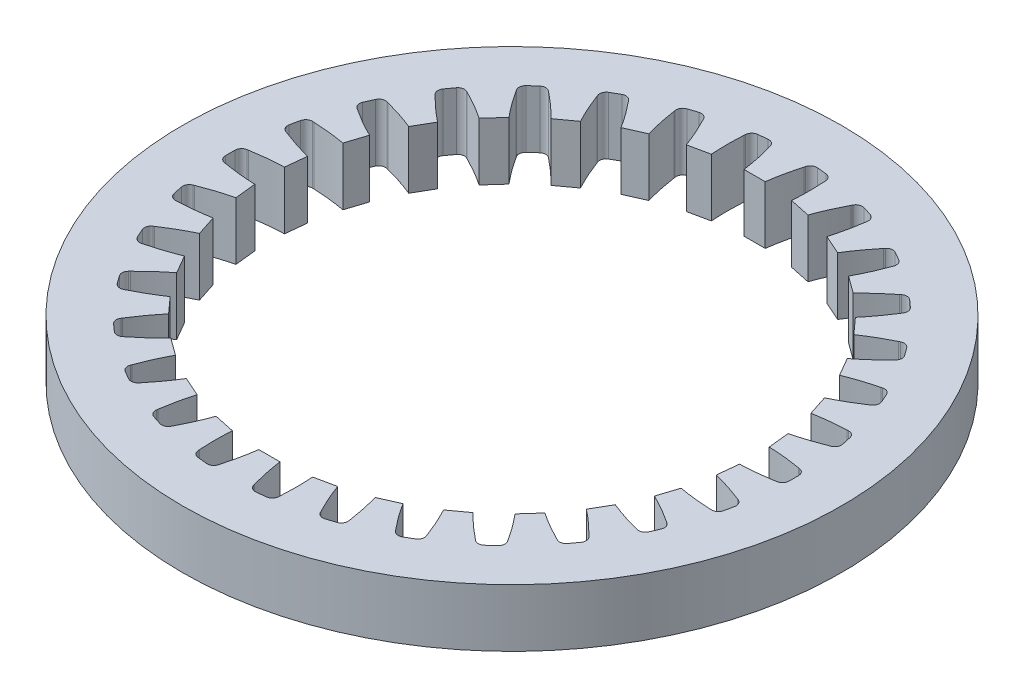
from build123d import *

# Parameters (mm, degrees)
SKETCH1_R                = 28.5
SKETCH1_R_2              = 24.375
BOSS_EXTRUDE1_DEPTH      = 5
BOSS_EXTRUDE2_DEPTH      = 5
FILLET1_R                = 0.57
CIRPATTERN1_COUNT        = 30
FILLET1_OF_CIRPATTERN1_R = 0.57


with BuildPart() as part:
    # Sketch1 → Boss-Extrude1 (new body)
    with BuildSketch(Plane(origin=(0, 0, 0), x_dir=(1, 0, 0), z_dir=(0, 1, 0))):
        with Locations(Location((0, 0, 0), (0, 0, 270))):
            Circle(SKETCH1_R)
        with Locations(Location((0, 0, 0), (0, 0, 270))):
            Circle(SKETCH1_R_2, mode=Mode.SUBTRACT)
    extrude(amount=BOSS_EXTRUDE1_DEPTH)

    # Boss-Extrude2: read off the stored shape, not the designer's step
    # Boss-Extrude2 outline → Boss-Extrude2 (add)
    with BuildSketch(Plane(origin=(0, 0, 0), x_dir=(1, 0, 0), z_dir=(0, 1, 0))):
        with BuildLine():
            add(Edge.make_bspline(
                [(1.496576928, 23.757908552), (1.490872064, 23.737730431), (1.479621713, 23.697623198), (1.452900431, 23.601697302), (1.431996618, 23.523999682), (1.4030873, 23.416136001), (1.379768971, 23.326178692), (1.35385064, 23.225216933), (1.330278027, 23.130670662), (1.30606993, 23.032143999), (1.282992231, 22.935665466), (1.260038195, 22.838058304), (1.237702482, 22.740471112), (1.215863674, 22.643469045), (1.192125875, 22.534783171), (1.164178445, 22.404718197), (1.131263213, 22.243887956), (1.096341374, 22.068969952), (1.057993263, 21.862152284), (1.025169174, 21.681270579), (0.988261449, 21.458291694), (0.962769382, 21.303236822), (0.933100411, 21.102482119), (0.921386202, 21.021560623), (0.915528251, 20.980033556)],
                knots=[0.077190427, 0.077190427, 0.077190427, 0.077190427, 0.077190427, 0.106723166, 0.136255482, 0.165787755, 0.195320079, 0.22485234, 0.254384656, 0.283916928, 0.313449243, 0.342981523, 0.37251383, 0.402046108, 0.431578426, 0.461110694, 0.502656144, 0.561720727, 0.620785314, 0.67984991, 0.738914489, 0.797979077, 0.857043671, 0.916108265, 0.916108265, 0.916108265, 0.916108265, 0.916108265], degree=4))
            Line((1.496576928, 23.757908552), (1.655138274, 24.318740557))
            ThreePointArc((1.655138274, 24.318740557), (1.6e-08, 24.375), (-1.655138243, 24.318740559))
            Line((-1.655138243, 24.318740559), (-1.496576663, 23.757907616))
            add(Edge.make_bspline(
                [(-1.496576663, 23.757907616), (-1.490871803, 23.737729502), (-1.479621457, 23.697622282), (-1.452900188, 23.601696418), (-1.431996386, 23.523998823), (-1.403087083, 23.416135178), (-1.379768766, 23.326177899), (-1.353850448, 23.225216173), (-1.330277846, 23.130669933), (-1.306069761, 23.032143303), (-1.282992074, 22.935664803), (-1.260038049, 22.838057673), (-1.237702346, 22.740470514), (-1.215863548, 22.643468479), (-1.192125761, 22.534782642), (-1.164178343, 22.404717712), (-1.131263126, 22.243887525), (-1.096341302, 22.068969581), (-1.057993208, 21.862151983), (-1.025169133, 21.68127034), (-0.988261422, 21.45829153), (-0.962769366, 21.303236712), (-0.933100405, 21.102482076), (-0.9213862, 21.021560609), (-0.915528251, 20.980033556)],
                knots=[0.077190087, 0.077190087, 0.077190087, 0.077190087, 0.077190087, 0.106723169, 0.136255484, 0.165787757, 0.195320082, 0.224852342, 0.254384658, 0.28391693, 0.313449245, 0.342981525, 0.372513832, 0.40204611, 0.431578428, 0.461110695, 0.502656145, 0.561720729, 0.620785315, 0.679849911, 0.73891449, 0.797979078, 0.857043671, 0.916108265, 0.916108265, 0.916108265, 0.916108265, 0.916108265], degree=4))
            Line((-0.915528251, 20.980033556), (0.915528251, 20.980033556))
        make_face()
    boss_extrude2 = extrude(amount=BOSS_EXTRUDE2_DEPTH)

    # Fillet1
    fillet1_edges = [part.edges().sort_by_distance(p)[0] for p in [
        (1.655138274, 2.5, -24.318740557),
        (-1.655138243, 2.5, -24.318740559),
    ]]
    fillet(fillet1_edges, radius=FILLET1_R)

    # CirPattern1: Boss-Extrude2 ×30 about axis
    cirpattern1_axis = Axis((0, 5, 0), (0, 1, 0))
    for i in range(1, CIRPATTERN1_COUNT):
        add(boss_extrude2.rotate(cirpattern1_axis, i * 360 / CIRPATTERN1_COUNT))

    # Fillet1 of CirPattern1
    fillet1_of_cirpattern1_edges = [part.edges().sort_by_distance(p)[0] for p in [
        (-3.437180936, 2.5, -24.131440326),
        (-6.675119969, 2.5, -23.44319514),
        (-8.379278846, 2.5, -22.889480357),
        (-11.403366922, 2.5, -21.5430696),
        (-12.955162062, 2.5, -20.64714026),
        (-15.633232022, 2.5, -18.701408544),
        (-16.96484253, 2.5, -17.502421059),
        (-19.179849865, 2.5, -15.042406195),
        (-20.233077973, 2.5, -13.592762071),
        (-21.888216234, 2.5, -10.725978514),
        (-22.61703082, 2.5, -9.089034155),
        (-23.639962522, 2.5, -5.940774103),
        (-24.012510891, 2.5, -4.188071832),
        (-24.358529011, 2.5, -0.895929357),
        (-24.358529012, 2.5, 0.895929326),
        (-24.012510897, 2.5, 4.188071802),
        (-23.63996253, 2.5, 5.940774073),
        (-22.617030832, 2.5, 9.089034126),
        (-21.888216247, 2.5, 10.725978486),
        (-20.233077991, 2.5, 13.592762045),
        (-19.179849884, 2.5, 15.042406171),
        (-16.964842552, 2.5, 17.502421037),
        (-15.633232045, 2.5, 18.701408524),
        (-12.955162088, 2.5, 20.647140244),
        (-11.40336695, 2.5, 21.543069586),
        (-8.379278875, 2.5, 22.889480346),
        (-6.675119999, 2.5, 23.443195132),
        (-3.437180967, 2.5, 24.131440321),
        (-1.655138274, 2.5, 24.318740557),
        (1.655138243, 2.5, 24.318740559),
        (3.437180936, 2.5, 24.131440326),
        (6.675119969, 2.5, 23.44319514),
        (8.379278846, 2.5, 22.889480357),
        (11.403366922, 2.5, 21.5430696),
        (12.955162062, 2.5, 20.64714026),
        (15.633232022, 2.5, 18.701408544),
        (16.96484253, 2.5, 17.502421059),
        (19.179849865, 2.5, 15.042406195),
        (20.233077973, 2.5, 13.592762071),
        (21.888216234, 2.5, 10.725978514),
        (22.61703082, 2.5, 9.089034155),
        (23.639962522, 2.5, 5.940774103),
        (24.012510891, 2.5, 4.188071832),
        (24.358529011, 2.5, 0.895929357),
        (24.358529012, 2.5, -0.895929326),
        (24.012510897, 2.5, -4.188071802),
        (23.63996253, 2.5, -5.940774073),
        (22.617030832, 2.5, -9.089034126),
        (21.888216247, 2.5, -10.725978486),
        (20.233077991, 2.5, -13.592762045),
        (19.179849884, 2.5, -15.042406171),
        (16.964842552, 2.5, -17.502421037),
        (15.633232045, 2.5, -18.701408524),
        (12.955162088, 2.5, -20.647140244),
        (11.40336695, 2.5, -21.543069586),
        (8.379278875, 2.5, -22.889480346),
        (6.675119999, 2.5, -23.443195132),
        (3.437180967, 2.5, -24.131440321),
    ]]
    fillet(fillet1_of_cirpattern1_edges, radius=FILLET1_OF_CIRPATTERN1_R)


solid = part.part
